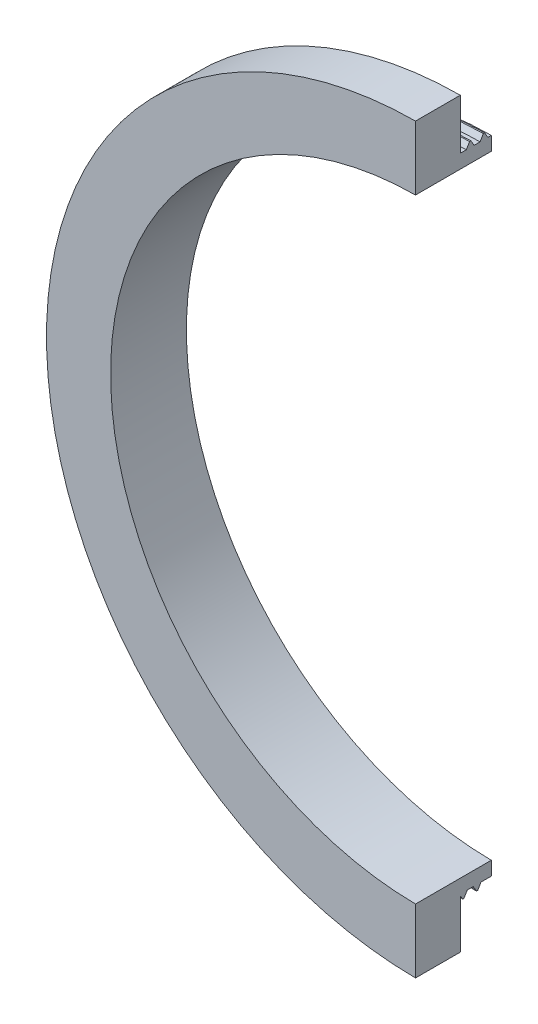
from build123d import *

# Parameters (mm, degrees)
SKETCH1_R               = 53.85
SKETCH1_R_2             = 44.55
BOSS_EXTRUDE1_DEPTH     = 6.5
BOSS_EXTRUDE2_START     = 4.5
SKETCH2_R               = 46.55
SKETCH2_R_2             = 44.55
BOSS_EXTRUDE2_DEPTH     = 4.5
THREAD1_PITCH           = 2
CUT_EXTRUDE1_DEPTH      = 77.945752542
CUT_EXTRUDE1_DEPTH_BACK = 77.945752542
SKETCH5_W               = 100.134263618
SKETCH5_H               = 233.46447918


with BuildPart() as part:
    # Sketch1 → Boss-Extrude1 (new body)
    with BuildSketch(Plane.XY):
        with Locations(Location((0, 0, 0), (0, 0, 180))):
            Circle(SKETCH1_R)
        with Locations(Location((0, 0, 0), (0, 0, 180))):
            Circle(SKETCH1_R_2, mode=Mode.SUBTRACT)
    extrude(amount=BOSS_EXTRUDE1_DEPTH)

    # Sketch2 → Boss-Extrude2 (add)
    with BuildSketch(Plane(origin=(0, 0, 0), x_dir=(-1, 0, 0), z_dir=(0, 0, -1)).offset(BOSS_EXTRUDE2_START)):
        with Locations(Location((0, 0, 0), (0, 0, 180))):
            Circle(SKETCH2_R)
        Circle(SKETCH2_R_2, mode=Mode.SUBTRACT)
    extrude(amount=-BOSS_EXTRUDE2_DEPTH)

    # Thread1: the profile of Thread Profile1 profile screwed along a right-hand helix of 5 turns, 10 arcs to a turn; built about Z, then put on its axis
    thread1_z = Axis((0, 0, 0), (0, 0, 1))
    thread1_corners = [(46.5497, 0, -0.000173205), (47.361898813, 0, 0.468749998), (47.361898813, 0, 0.656249998), (46.5497, 0, 1.125173201)]
    with BuildLine(mode=Mode.PRIVATE) as thread1_profile:
        Line(thread1_corners[0], thread1_corners[1])
        Line(thread1_corners[1], thread1_corners[2])
        Line(thread1_corners[2], thread1_corners[3])
        Line(thread1_corners[3], thread1_corners[0])
    thread1_cap = Face(thread1_profile.wire())
    thread1_turn_angles = [0, 18, 36, 54, 72, 90, 108, 126, 144, 162, 180, 198, 216, 234, 252, 270, 288, 306, 324, 342, 360]
    thread1_turn_weights = [1, 0.9510565162951535, 1, 0.9510565162951535, 1, 0.9510565162951535, 1, 0.9510565162951535, 1, 0.9510565162951535, 1, 0.9510565162951535, 1, 0.9510565162951535, 1, 0.9510565162951535, 1, 0.9510565162951535, 1, 0.9510565162951535, 1]
    thread1_turn_rails = [Edge.make_bspline([Vector(p[0], p[1], 0).rotate(thread1_z, thread1_turn_angles[k]) / thread1_turn_weights[k] + Vector(0, 0, p[2] + THREAD1_PITCH * thread1_turn_angles[k] / 360) for k in range(21)], [0, 0, 0, 1, 1, 2, 2, 3, 3, 4, 4, 5, 5, 6, 6, 7, 7, 8, 8, 9, 9, 10, 10, 10], 2, thread1_turn_weights) for p in thread1_corners]
    thread1_turn_sides = [Face.make_surface_from_curves(thread1_turn_rails[p[0]], thread1_turn_rails[p[1]]) for p in [(0, 1), (1, 2), (2, 3), (3, 0)]]
    thread1 = Plane(origin=(0, 0, -4.5), x_dir=(1, 0, 0), z_dir=(0, 0, 1)) * Solid(Shell([*[p.moved(Location((0, 0, THREAD1_PITCH * i))) for i in range(5) for p in thread1_turn_sides], thread1_cap, thread1_cap.rotate(thread1_z, 1800).moved(Location((0, 0, THREAD1_PITCH * 1800 / 360)))]))
    add(thread1)

    # Sketch5 → Cut-Extrude1 (cut, two sides: drawn at the far end of the back side and taken through both)
    with BuildSketch(Plane.XY.offset(6.5).offset(-CUT_EXTRUDE1_DEPTH_BACK)):
        with Locations((49.767131809, 0)):
            Rectangle(SKETCH5_W, SKETCH5_H)
    extrude(amount=CUT_EXTRUDE1_DEPTH + CUT_EXTRUDE1_DEPTH_BACK, mode=Mode.SUBTRACT)


solid = part.part
